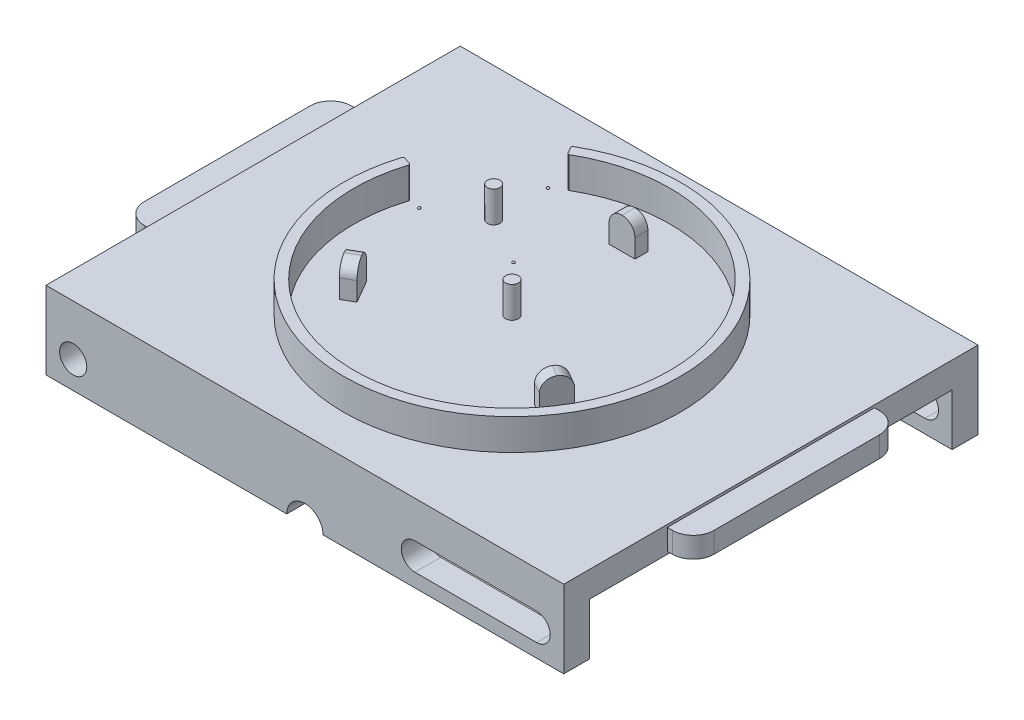
from build123d import *

# Parameters (mm, degrees)
SKIZZE1_W                            = 200
SKIZZE1_H                            = 160
AUFSATZ_LINEAR_AUSTRAGEN1_DEPTH      = 5
SKIZZE2_W                            = 200
SKIZZE2_H                            = 10
AUFSATZ_LINEAR_AUSTRAGEN2_DEPTH      = 20
SCHNITT_LINEAR_AUSTRAGEN1_DEPTH      = 131.479883507
SCHNITT_LINEAR_AUSTRAGEN1_DEPTH_BACK = 131.479883507
SKIZZE3_R                            = 5.25
SKIZZE4_R                            = 2.45
AUFSATZ_LINEAR_AUSTRAGEN3_DEPTH      = 12
FASE1_SIZE                           = 0.4
AUFSATZ_LINEAR_AUSTRAGEN4_DEPTH      = 12.2
AUFSATZ_LINEAR_AUSTRAGEN4_2_DEPTH    = 12.2
SKIZZE6_W                            = 10
SKIZZE6_H                            = 5
AUFSATZ_LINEAR_AUSTRAGEN4_3_DEPTH    = 12.2
VERRUNDUNG1_R                        = 5
VERRUNDUNG2_R                        = 5
VERRUNDUNG3_R                        = 5
SKIZZE7_W                            = 10
SKIZZE7_H                            = 80
AUFSATZ_LINEAR_AUSTRAGEN5_DEPTH      = 4
VERRUNDUNG4_R                        = 8
SKIZZE8_R                            = 0.5
AUFSATZ_LINEAR_AUSTRAGEN6_DEPTH      = 0.5
VERRUNDUNG5_R                        = 0.5


with BuildPart() as part:
    # Skizze1 → Aufsatz-Linear austragen1 (new, symmetric)
    with BuildSketch(Plane(origin=(0, 0, 0), x_dir=(1, 0, 0), z_dir=(0, 1, 0))):
        Rectangle(SKIZZE1_W, SKIZZE1_H)
    extrude(amount=AUFSATZ_LINEAR_AUSTRAGEN1_DEPTH, both=True)

    # Skizze2 → Aufsatz-Linear austragen2 (add)
    with BuildSketch(Plane(origin=(0, -5, 0), x_dir=(-1, 0, 0), z_dir=(0, -1, 0))):
        with Locations((0, 75)):
            Rectangle(SKIZZE2_W, SKIZZE2_H)
        with Locations((0, -75)):
            Rectangle(SKIZZE2_W, SKIZZE2_H)
    extrude(amount=AUFSATZ_LINEAR_AUSTRAGEN2_DEPTH)

    # Skizze3 → Schnitt-Linear austragen1 (cut, two sides: drawn at the far end of the back side and taken through both)
    with BuildSketch(Plane.XY.offset(-SCHNITT_LINEAR_AUSTRAGEN1_DEPTH_BACK)):
        with Locations((-89.5, -14.5)):
            Circle(SKIZZE3_R)
        with BuildLine():
            Line((42.5, -9.25), (89.5, -9.25))
            ThreePointArc((89.5, -9.25), (94.75, -14.5), (89.5, -19.75))
            Line((89.5, -19.75), (42.5, -19.75))
            ThreePointArc((42.5, -19.75), (37.25, -14.5), (42.5, -9.25))
        make_face()
        with BuildLine():
            Line((-7, -25), (7, -25))
            ThreePointArc((7, -25), (0, -18), (-7, -25))
        make_face()
    extrude(amount=SCHNITT_LINEAR_AUSTRAGEN1_DEPTH + SCHNITT_LINEAR_AUSTRAGEN1_DEPTH_BACK, mode=Mode.SUBTRACT)

    # Skizze4 → Aufsatz-Linear austragen3 (add)
    with BuildSketch(Plane(origin=(0, 5, 0), x_dir=(1, 0, 0), z_dir=(0, 1, 0))):
        with Locations(Location((0, 0, 0), (0, 0, 270))):
            Circle(SKIZZE4_R)
        with Locations(Location((-35.451443949, 28.361155159, 0), (0, 0, 270))):
            Circle(SKIZZE4_R)
        with BuildLine():
            Line((-58.035118175, 18.786299755), (-61.840699694, 20.018188263))
            ThreePointArc((-61.840699694, 20.018188263), (50.756472614, -40.605178091), (-33.104727507, 55.938153498))
            Line((-33.104727507, 55.938153498), (-31.067513506, 52.49580559))
            ThreePointArc((-31.067513506, 52.49580559), (47.632997376, -38.106397901), (-58.035118175, 18.786299755))
        make_face()
    extrude(amount=AUFSATZ_LINEAR_AUSTRAGEN3_DEPTH)

    # Fase1
    fase1_edges = [part.edges().sort_by_distance(p)[0] for p in [
        (-31.067513506, 11, -52.49580559),
        (-58.035118175, 11, -18.786299755),
        (-61.840699694, 11, -20.018188263),
        (-33.104727507, 11, -55.938153498),
    ]]
    chamfer(fase1_edges, length=FASE1_SIZE)

    # Skizze7 → Aufsatz-Linear austragen5 (add, symmetric)
    with BuildSketch(Plane(origin=(0, 0, 0), x_dir=(1, 0, 0), z_dir=(0, 1, 0))):
        with Locations((-105, 0)):
            Rectangle(SKIZZE7_W, SKIZZE7_H)
        with Locations((105, 0)):
            Rectangle(SKIZZE7_W, SKIZZE7_H)
    extrude(amount=AUFSATZ_LINEAR_AUSTRAGEN5_DEPTH, both=True)

    # Verrundung4
    verrundung4_edges = [part.edges().sort_by_distance(p)[0] for p in [
        (-110, 0, -40),
        (-110, 0, 40),
        (110, 0, -40),
        (110, 0, 40),
    ]]
    fillet(verrundung4_edges, radius=VERRUNDUNG4_R)

    # Skizze8 → Aufsatz-Linear austragen6 (add)
    with BuildSketch(Plane(origin=(0, 5, 0), x_dir=(1, 0, 0), z_dir=(0, 1, 0))):
        with Locations(Location((-35.451443949, 49.361155159, 0), (0, 0, 270))):
            Circle(SKIZZE8_R)
        with Locations(Location((-53.637977428, 17.861155159, 0), (0, 0, 270))):
            Circle(SKIZZE8_R)
        with Locations(Location((-17.264910469, 17.861155159, 0), (0, 0, 270))):
            Circle(SKIZZE8_R)
    extrude(amount=AUFSATZ_LINEAR_AUSTRAGEN6_DEPTH)

    # Verrundung5
    verrundung5_edges = [part.edges().sort_by_distance(p)[0] for p in [
        (-35.451443949, 5.5, -49.861155159),
        (-53.637977428, 5.5, -18.361155159),
        (-17.264910469, 5.5, -18.361155159),
    ]]
    fillet(verrundung5_edges, radius=VERRUNDUNG5_R - 0.0001)  # a hair under: the kernel refuses the full size


with BuildPart() as body_2:
    # Skizze6 → Aufsatz-Linear austragen4 (new body)
    with BuildSketch(Plane(origin=(0, 5, 0), x_dir=(1, 0, 0), z_dir=(0, 1, 0))):
        Polygon((43.63620668, -19.419872981), (39.306079661, -16.919872981), (34.306079661, -25.580127019), (38.63620668, -28.080127019), align=None)
    extrude(amount=AUFSATZ_LINEAR_AUSTRAGEN4_DEPTH)

    # Verrundung1
    verrundung1_edges = [body_2.edges().sort_by_distance(p)[0] for p in [
        (36.47114317, 17.2, 26.830127019),
        (41.47114317, 17.2, 18.169872981),
    ]]
    fillet(verrundung1_edges, radius=VERRUNDUNG1_R - 0.0001)  # a hair under: the kernel refuses the full size


with BuildPart() as body_3:
    # Skizze6 → Aufsatz-Linear austragen4 2 (new body)
    with BuildSketch(Plane(origin=(0, 5, 0), x_dir=(1, 0, 0), z_dir=(0, 1, 0))):
        Polygon((-34.306079661, -25.580127019), (-39.306079661, -16.919872981), (-43.63620668, -19.419872981), (-38.63620668, -28.080127019), align=None)
    extrude(amount=AUFSATZ_LINEAR_AUSTRAGEN4_2_DEPTH)

    # Verrundung2
    verrundung2_edges = [body_3.edges().sort_by_distance(p)[0] for p in [
        (-36.47114317, 17.2, 26.830127019),
        (-41.47114317, 17.2, 18.169872981),
    ]]
    fillet(verrundung2_edges, radius=VERRUNDUNG2_R - 0.0001)  # a hair under: the kernel refuses the full size


with BuildPart() as body_4:
    # Skizze6 → Aufsatz-Linear austragen4 3 (new body)
    with BuildSketch(Plane(origin=(0, 5, 0), x_dir=(1, 0, 0), z_dir=(0, 1, 0))):
        with Locations((0, 45)):
            Rectangle(SKIZZE6_W, SKIZZE6_H)
    extrude(amount=AUFSATZ_LINEAR_AUSTRAGEN4_3_DEPTH)

    # Verrundung3
    verrundung3_edges = [body_4.edges().sort_by_distance(p)[0] for p in [
        (-5, 17.2, -45),
        (5, 17.2, -45),
    ]]
    fillet(verrundung3_edges, radius=VERRUNDUNG3_R - 0.0001)  # a hair under: the kernel refuses the full size


solid = Compound([part.part, body_2.part, body_3.part, body_4.part])
